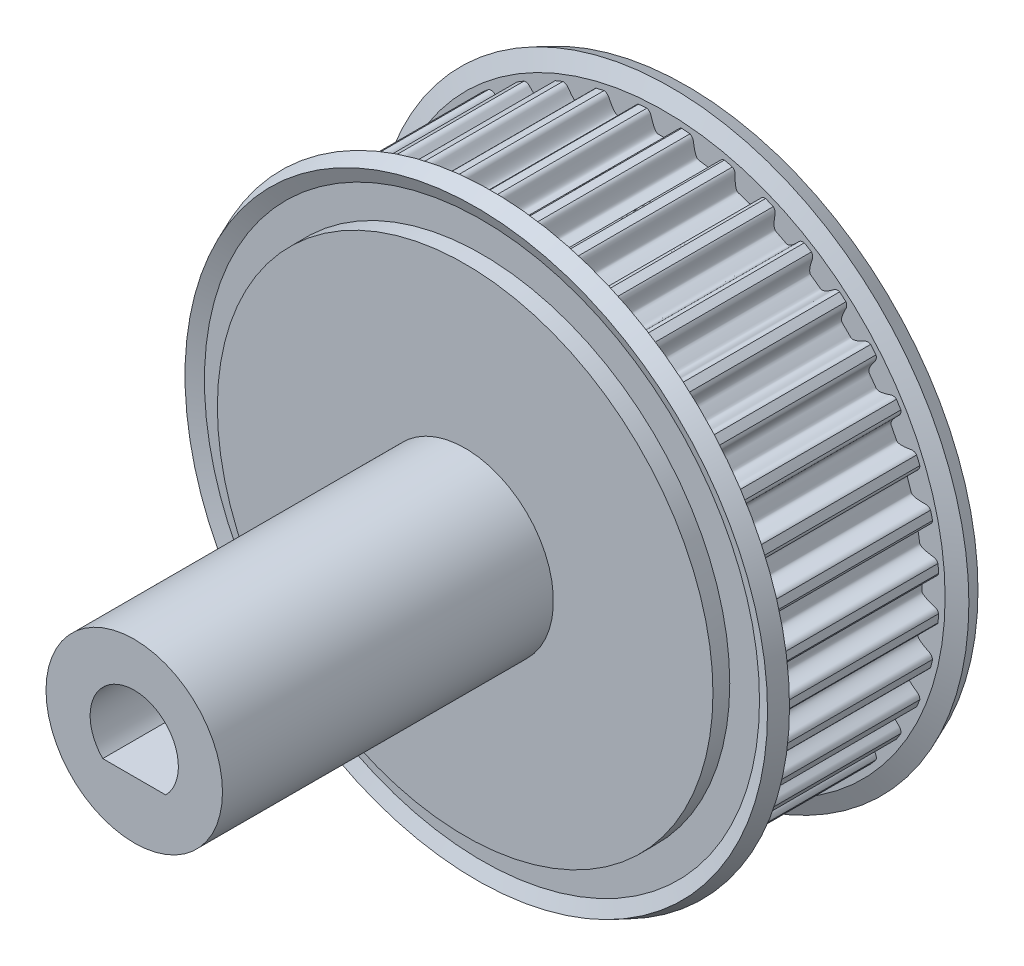
from build123d import *

# Parameters (mm, degrees)
TOOTHEXTRUDECUTGEARBELT01_DEPTH = 3.749999944
TOOTH_PATTERN_40_COUNT          = 40
BOREREVOLVESKETCH_W             = 10.547999842
BOREREVOLVESKETCH_H             = 5
SKETCH_5_R                      = 5
EXTRUDE_1_DEPTH                 = 10
SKETCH_6_R                      = 4
EXTRUDE_3_DEPTH                 = 15
SKETCH_7_R                      = 1.940283386
CUT_EXTRUDE_3_DEPTH             = 25.273388845
CUT_EXTRUDE_4_DEPTH             = 29.54779826


with BuildPart() as part:
    # SketchRevolveGearBelt01 → Gates_PowerGrip_GT_2mm, 6mm Belt Width (revolve)
    with BuildSketch(Plane(origin=(0, 0, 0), x_dir=(0, 0, -1), z_dir=(1, 0, 0))):
        Polygon((5.273999921, 0), (5.273999921, 11.232395279), (4.511999932, 11.232395279), (4.511999932, 12.580824034), (4.769626867, 13.202790474), (4.065630673, 13.494395245), (3.749999944, 12.732395256), (3.749999944, 12.46357944), (-3.749999944, 12.46357944), (-3.749999944, 12.732395256), (-4.065630673, 13.494395245), (-4.769626867, 13.202790474), (-4.511999932, 12.580824034), (-4.511999932, 11.232395279), (-5.273999921, 11.232395279), (-5.273999921, 0), align=None)
    revolve(axis=Axis((0, 0, 0), (0, 0, -1)))

    # SketchToothGearBelt01 → ToothExtrudeCutGearBelt01 (cut, symmetric)
    with BuildSketch(Plane.XY):
        with BuildLine():
            ThreePointArc((12.448081962, 0.861658269), (12.477868388, 0), (12.448081962, -0.861658269))
            add(Edge.make_bspline(
                [(12.448081962, -0.861658269), (12.44814702, -0.844334276), (12.445695517, -0.81834059), (12.437448736, -0.784646245), (12.428834635, -0.76009708), (12.417872883, -0.736502489), (12.404667606, -0.714086272), (12.389343998, -0.693061347), (12.372047733, -0.673626365), (12.352941906, -0.65596886), (12.332211579, -0.640244684), (12.310039342, -0.626646652), (12.286688204, -0.615140987), (12.247627049, -0.601278558), (12.197669543, -0.58617458), (12.138567847, -0.567480542), (12.086118353, -0.549825827), (12.036838798, -0.532186864), (11.990734623, -0.514546576), (11.947803409, -0.496909287), (11.908044361, -0.479273964), (11.871455882, -0.461640694), (11.838036062, -0.444008949), (11.807782407, -0.426377751), (11.780691891, -0.408745201), (11.756760686, -0.391107907), (11.735985493, -0.373460068), (11.718361421, -0.355792311), (11.703894927, -0.33809054), (11.692574161, -0.320336691), (11.684488288, -0.302512788), (11.679447526, -0.28461649), (11.677246281, -0.250312541), (11.680428548, -0.199994192), (11.680572602, -0.1333067), (11.681341135, -0.066656855), (11.681455207, 0), (11.681341135, 0.066656855), (11.680572602, 0.1333067), (11.680428548, 0.199994192), (11.677246281, 0.250312541), (11.679447526, 0.28461649), (11.684488288, 0.302512788), (11.692574161, 0.320336691), (11.703894927, 0.33809054), (11.718361421, 0.355792311), (11.735985493, 0.373460068), (11.756760686, 0.391107907), (11.780691891, 0.408745201), (11.807782407, 0.426377751), (11.838036062, 0.444008949), (11.871455882, 0.461640694), (11.908044361, 0.479273964), (11.947803409, 0.496909287), (11.990734623, 0.514546576), (12.036838798, 0.532186864), (12.086118353, 0.549825827), (12.138567847, 0.567480542), (12.197669543, 0.58617458), (12.247627049, 0.601278558), (12.286688204, 0.615140987), (12.310039342, 0.626646652), (12.332211579, 0.640244684), (12.352941906, 0.65596886), (12.372047733, 0.673626365), (12.389343998, 0.693061347), (12.404667606, 0.714086272), (12.417872883, 0.736502489), (12.428834635, 0.76009708), (12.437448736, 0.784646245), (12.445695517, 0.81834059), (12.44814702, 0.844334276), (12.448081962, 0.861658269)],
                knots=[0, 0, 0, 0, 0.019855995, 0.029783993, 0.03971199, 0.049639988, 0.059567985, 0.069495983, 0.07942398, 0.089351978, 0.099279975, 0.109207973, 0.11913597, 0.129063968, 0.156684055, 0.178986737, 0.200134998, 0.220135968, 0.238998082, 0.256731398, 0.273348024, 0.288862686, 0.303293478, 0.3166629, 0.328999259, 0.340338602, 0.35072736, 0.360225913, 0.368913222, 0.376892371, 0.38429608, 0.39128991, 0.398069514, 0.423571008, 0.449047338, 0.474523669, 0.5, 0.525476331, 0.550952662, 0.576428992, 0.601930486, 0.60871009, 0.61570392, 0.623107629, 0.631086778, 0.639774087, 0.64927264, 0.659661398, 0.671000741, 0.6833371, 0.696706522, 0.711137314, 0.726651976, 0.743268602, 0.761001918, 0.779864032, 0.799865002, 0.821013263, 0.843315945, 0.870936032, 0.88086403, 0.890792027, 0.900720025, 0.910648022, 0.92057602, 0.930504017, 0.940432015, 0.950360012, 0.96028801, 0.970216007, 0.980144005, 1, 1, 1, 1], degree=3))
        make_face()
    toothextrudecutgearbelt01 = extrude(amount=TOOTHEXTRUDECUTGEARBELT01_DEPTH, both=True, mode=Mode.SUBTRACT)

    # Tooth Pattern, 40: ToothExtrudeCutGearBelt01 ×40 about axis
    tooth_pattern_40_axis = Axis((0, 0, 55), (0, 0, -1))
    for i in range(1, TOOTH_PATTERN_40_COUNT):
        add(toothextrudecutgearbelt01.rotate(tooth_pattern_40_axis, i * 360 / TOOTH_PATTERN_40_COUNT), mode=Mode.SUBTRACT)

    # BoreRevolveSketch → BoreRevolveCut (revolve, cut)
    with BuildSketch(Plane(origin=(0, 0, 0), x_dir=(0, 0, -1), z_dir=(1, 0, 0))):
        with Locations((0, 2.5)):
            Rectangle(BOREREVOLVESKETCH_W, BOREREVOLVESKETCH_H)
    revolve(axis=Axis((0, 0, 0), (0, 0, -1)), mode=Mode.SUBTRACT)

    # 草图5 → 凸台-拉伸1 (add)
    with BuildSketch(Plane.XY.offset(5.273999921)):
        Circle(SKETCH_5_R)
    extrude(amount=-EXTRUDE_1_DEPTH)

    # 草图6 → 凸台-拉伸3 (add)
    with BuildSketch(Plane.XY.offset(5.273999921)):
        Circle(SKETCH_6_R)
        with BuildLine():
            Line((1.428285686, -1.4), (-1.428285686, -1.4))
            ThreePointArc((-1.428285686, -1.4), (0, 2), (1.428285686, -1.4))
        make_face(mode=Mode.SUBTRACT)
    extrude(amount=EXTRUDE_3_DEPTH)

    # 草图7 → 切除-拉伸3 (cut, through all)
    with BuildSketch(Plane.XY.offset(5.273999921)):
        Circle(SKETCH_7_R)
    extrude(amount=-CUT_EXTRUDE_3_DEPTH, mode=Mode.SUBTRACT)

    # 草图8 → 切除-拉伸4 (cut, through all)
    with BuildSketch(Plane(origin=(0, -1.4, 0), x_dir=(1, 0, 0), z_dir=(0, 1, 0))):
        with BuildLine():
            Line((1.428285686, -16.73225749), (1.428285686, -15.815742351))
            ThreePointArc((1.428285686, -15.815742351), (0, -14.773999921), (-1.428285686, -15.815742351))
            Line((-1.428285686, -15.815742351), (-1.428285686, -16.73225749))
            ThreePointArc((-1.428285686, -16.73225749), (-0.88391562, -17.485896442), (0, -17.773999921))
            ThreePointArc((0, -17.773999921), (0.88391562, -17.485896442), (1.428285686, -16.73225749))
        make_face()
    extrude(amount=-CUT_EXTRUDE_4_DEPTH, mode=Mode.SUBTRACT)


solid = part.part
